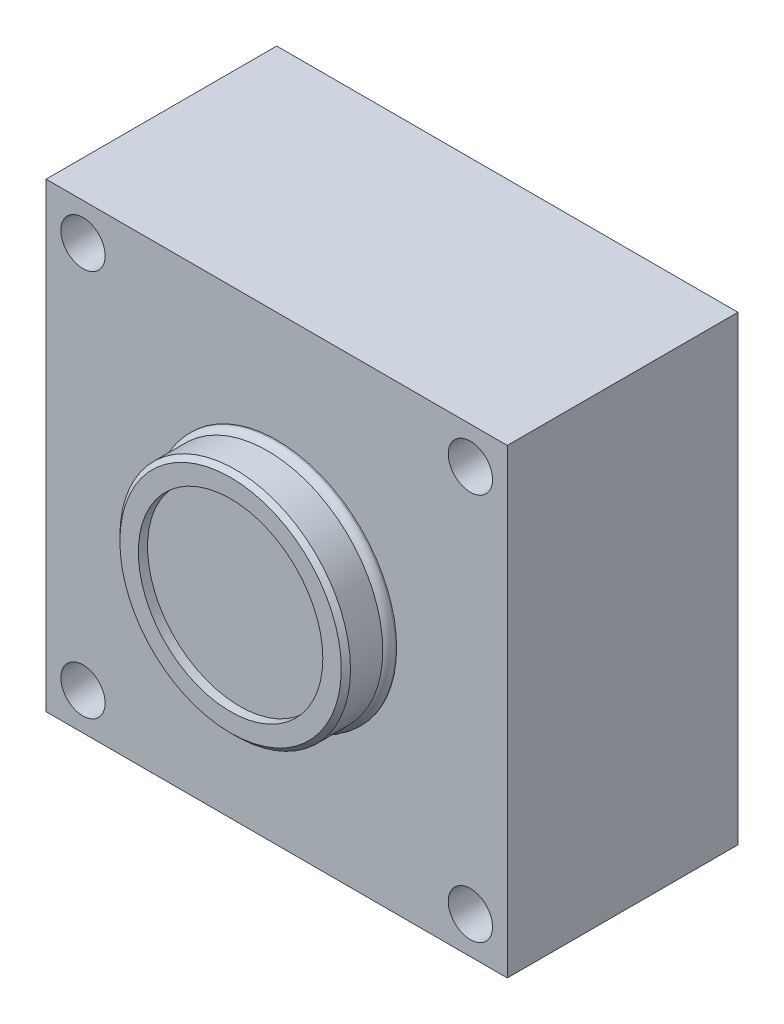
from build123d import *

# Parameters (mm, degrees)
SKETCH1_W            = 50
SKETCH1_H            = 50
BOSS_EXTRUDE1_DEPTH  = 12.5
SKETCH2_R            = 12.5
BOSS_EXTRUDE2_DEPTH  = 5
CUT_EXTRUDE1_REACH   = 45.301
SKETCH4_R            = 2.4
SKETCH5_R            = 13
BOSS_EXTRUDE3_DEPTH  = 1
SHELL1_START         = -10.5
SHELL1_DEPTH         = 21
SHELL1_START_2       = 10.5
SHELL1_2_OUTLINE_R   = 10.5
SHELL1_2_DEPTH       = 4
SHELL1_3_OUTLINE_R   = 11
SHELL1_3_OUTLINE_R_2 = 10.5
SHELL1_3_DEPTH       = 1
FILLET1_R            = 3
SKETCH6_R            = 10
CUT_EXTRUDE2_DEPTH   = 1
FILLET2_R            = 1
CHAMFER1_SIZE        = 0.5
SKETCH7_R            = 2.5
BOSS_EXTRUDE4_DEPTH  = 8
BOSS_EXTRUDE4_TAPER  = 5


# Read off the part's stored shape, not the designer's step: Shell1
with BuildPart() as part:
    # Sketch1 → Boss-Extrude1 (new, symmetric)
    with BuildSketch(Plane.XY):
        Rectangle(SKETCH1_W, SKETCH1_H)
    extrude(amount=BOSS_EXTRUDE1_DEPTH, both=True)

    # Sketch2 → Boss-Extrude2 (add)
    with BuildSketch(Plane.XY.offset(12.5)):
        Circle(SKETCH2_R)
    extrude(amount=BOSS_EXTRUDE2_DEPTH)

    # Sketch4 → Cut-Extrude1 (cut, up to next)
    with BuildSketch(Plane.XY.offset(12.5), mode=Mode.PRIVATE) as cut_extrude1_sk1:
        with Locations((-21, 21)):
            Circle(SKETCH4_R)
    cut_extrude1_tool1 = extrude(cut_extrude1_sk1.sketch, amount=-CUT_EXTRUDE1_REACH, mode=Mode.PRIVATE) & part.part
    # Sketch4 → Cut-Extrude1 (cut, up to next)
    with BuildSketch(Plane.XY.offset(12.5), mode=Mode.PRIVATE) as cut_extrude1_sk2:
        with Locations((21, 21)):
            Circle(SKETCH4_R)
    cut_extrude1_tool2 = extrude(cut_extrude1_sk2.sketch, amount=-CUT_EXTRUDE1_REACH, mode=Mode.PRIVATE) & part.part
    # Sketch4 → Cut-Extrude1 (cut, up to next)
    with BuildSketch(Plane.XY.offset(12.5), mode=Mode.PRIVATE) as cut_extrude1_sk3:
        with Locations((-21, -21)):
            Circle(SKETCH4_R)
    cut_extrude1_tool3 = extrude(cut_extrude1_sk3.sketch, amount=-CUT_EXTRUDE1_REACH, mode=Mode.PRIVATE) & part.part
    # Sketch4 → Cut-Extrude1 (cut, up to next)
    with BuildSketch(Plane.XY.offset(12.5), mode=Mode.PRIVATE) as cut_extrude1_sk4:
        with Locations((21, -21)):
            Circle(SKETCH4_R)
    cut_extrude1_tool4 = extrude(cut_extrude1_sk4.sketch, amount=-CUT_EXTRUDE1_REACH, mode=Mode.PRIVATE) & part.part
    add(cut_extrude1_tool1.solids().sort_by_distance((-21, 21, 12.5))[0], mode=Mode.SUBTRACT)
    add(cut_extrude1_tool2.solids().sort_by_distance((21, 21, 12.5))[0], mode=Mode.SUBTRACT)
    add(cut_extrude1_tool3.solids().sort_by_distance((-21, -21, 12.5))[0], mode=Mode.SUBTRACT)
    add(cut_extrude1_tool4.solids().sort_by_distance((21, -21, 12.5))[0], mode=Mode.SUBTRACT)

    # Sketch5 → Boss-Extrude3 (add)
    with BuildSketch(Plane.XY.offset(12.5)):
        Circle(SKETCH5_R)
    extrude(amount=BOSS_EXTRUDE3_DEPTH)

    # Shell1 outline → Shell1 (cut)
    with BuildSketch(Plane.XY.offset(SHELL1_START)):
        with BuildLine():
            Line((23, -17.080816412), (23, 17.080816412))
            ThreePointArc((23, 17.080816412), (17.888730163, 17.888730163), (17.080816412, 23))
            Line((17.080816412, 23), (-17.080816412, 23))
            ThreePointArc((-17.080816412, 23), (-17.888730163, 17.888730163), (-23, 17.080816412))
            Line((-23, 17.080816412), (-23, -17.080816412))
            ThreePointArc((-23, -17.080816412), (-17.888730163, -17.888730163), (-17.080816412, -23))
            Line((-17.080816412, -23), (17.080816412, -23))
            ThreePointArc((17.080816412, -23), (17.888730163, -17.888730163), (23, -17.080816412))
        make_face()
    extrude(amount=SHELL1_DEPTH, mode=Mode.SUBTRACT)

    # Shell1 2 outline → Shell1 2 (cut)
    with BuildSketch(Plane.XY.offset(SHELL1_START_2)):
        Circle(SHELL1_2_OUTLINE_R)
    extrude(amount=SHELL1_2_DEPTH, mode=Mode.SUBTRACT)

    # Shell1 3 outline → Shell1 3 (cut)
    with BuildSketch(Plane.XY.offset(SHELL1_START_2)):
        Circle(SHELL1_3_OUTLINE_R)
        Circle(SHELL1_3_OUTLINE_R_2, mode=Mode.SUBTRACT)
    extrude(amount=SHELL1_3_DEPTH, mode=Mode.SUBTRACT)

    # Fillet1
    fillet1_edges = [part.edges().sort_by_distance(p)[0] for p in [
        (23, 17.080816412, 0),
        (-17.080816412, 23, 0),
        (-23, -17.080816412, 0),
        (17.080816412, -23, 0),
        (-23, 17.080816412, 0),
        (-17.080816412, -23, 0),
        (17.080816412, 23, 0),
    ]]
    fillet(fillet1_edges, radius=FILLET1_R)

    # Sketch6 → Cut-Extrude2 (cut)
    with BuildSketch(Plane.XY.offset(17.5)):
        Circle(SKETCH6_R)
    extrude(amount=-CUT_EXTRUDE2_DEPTH, mode=Mode.SUBTRACT)

    # Fillet2
    # the kernel refuses this fillet: 1 mm, written as the material it takes off along each edge
    with BuildSketch(Plane(origin=(0, 0, 13.5), x_dir=(1, 0, 0), z_dir=(0, -1, 0))) as fillet2_piece_1:
        with BuildLine():
            CenterArc((12, -0.866025404), FILLET2_R, 0, 60)
            Line((12.5, 0), (12.51, 0.017320508))
            ThreePointArc((12.51, 0.017320508), (12.75, 0.02), (13, 0.02))
            Line((13, 0.02), (13.02, 0))
            Line((13.02, 0), (13.02, -0.866025404))
            Line((13.02, -0.866025404), (13, -0.866025404))
        make_face()
    revolve(axis=Axis((0, 0, 13.5), (0, 0, 1)), mode=Mode.SUBTRACT)

    # Chamfer1
    chamfer1_edges = [part.edges().sort_by_distance(p)[0] for p in [
        (-12.5, 0, 17.5),
    ]]
    chamfer(chamfer1_edges, length=CHAMFER1_SIZE)

    # Sketch7 → Boss-Extrude4 (add)
    with BuildSketch(Plane.XZ.offset(25)):
        with Locations((-19, -6.5)):
            Circle(SKETCH7_R)
    extrude(amount=BOSS_EXTRUDE4_DEPTH, taper=BOSS_EXTRUDE4_TAPER)


solid = part.part
